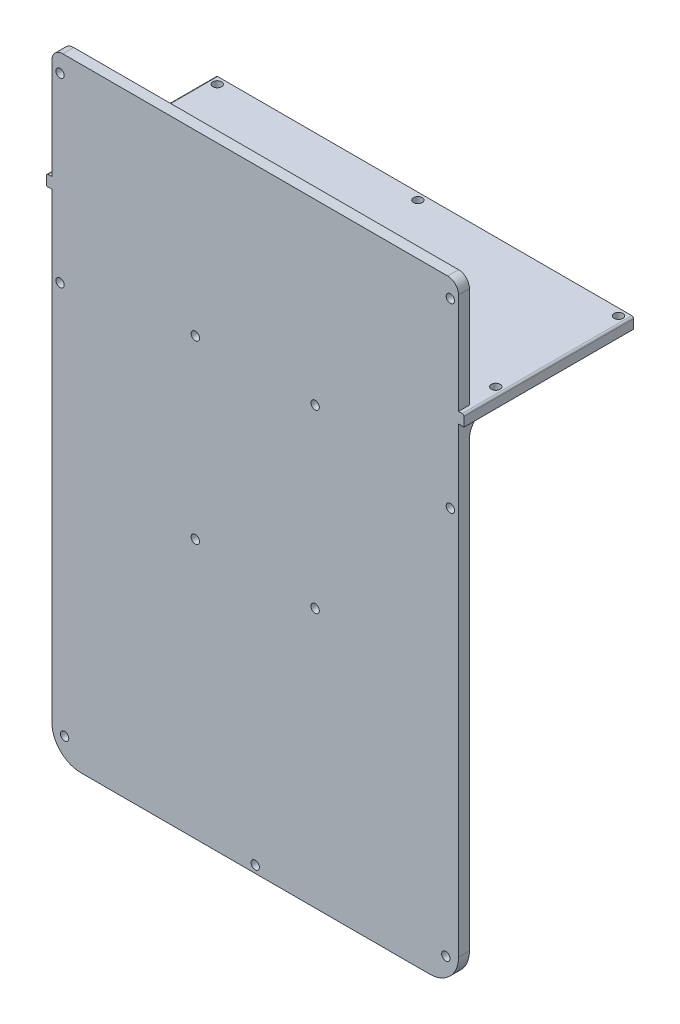
from build123d import *

# Parameters (mm, degrees)
BOSS_EXTRUDE3_DEPTH = 3
SKETCH3_W           = 115
SKETCH3_H           = 46.7
BOSS_EXTRUDE4_DEPTH = 3
FILLET3_R           = 5
FILLET6_R           = 0.5
SKETCH4_R           = 1.15
CUT_EXTRUDE1_DEPTH  = 161.690175681
SKETCH5_R           = 1.2
CUT_EXTRUDE2_DEPTH  = 154.280722858
SKETCH6_R           = 1.15
CUT_EXTRUDE6_DEPTH  = 161.690175681


with BuildPart() as part:
    # Sketch1 → Boss-Extrude3 (new body)
    with BuildSketch(Plane.XY):
        with BuildLine():
            Line((53, 143.545785589), (-53, 143.545785589))
            ThreePointArc((-53, 143.545785589), (-55.121320344, 142.667105932), (-56, 140.545785589))
            Line((-56, 140.545785589), (-56, -17.454214411))
            ThreePointArc((-56, -17.454214411), (-53.656854249, -23.111068661), (-48, -25.454214411))
            Line((-48, -25.454214411), (48, -25.454214411))
            ThreePointArc((48, -25.454214411), (53.656854249, -23.111068661), (56, -17.454214411))
            Line((56, -17.454214411), (56, 140.545785589))
            ThreePointArc((56, 140.545785589), (55.121320344, 142.667105932), (53, 143.545785589))
        make_face()
    extrude(amount=BOSS_EXTRUDE3_DEPTH)

    # Sketch3 → Boss-Extrude4 (add)
    with BuildSketch(Plane(origin=(0, 109.745785589, 0), x_dir=(1, 0, 0), z_dir=(0, 1, 0))):
        with Locations((0, 20.35)):
            Rectangle(SKETCH3_W, SKETCH3_H)
    extrude(amount=BOSS_EXTRUDE4_DEPTH)

    # Fillet3
    fillet3_edges = [part.edges().sort_by_distance(p)[0] for p in [
        (0, 109.745785589, 0),
    ]]
    fillet(fillet3_edges, radius=FILLET3_R)

    # Fillet6
    fillet6_edges = [part.edges().sort_by_distance(p)[0] for p in [
        (57.5, 112.745785589, -20.35),
        (-57.5, 112.745785589, -20.35),
    ]]
    fillet(fillet6_edges, radius=FILLET6_R)

    # Sketch4 → Cut-Extrude1 (cut, through all)
    with BuildSketch(Plane(origin=(0, 0, 0), x_dir=(-1, 0, 0), z_dir=(0, 0, -1))):
        with Locations((-52.5, -18.954214411)):
            Circle(SKETCH4_R)
        with Locations((-53.75, 88.545785589)):
            Circle(SKETCH4_R)
        with Locations((-53.75, 138.545785589)):
            Circle(SKETCH4_R)
        with Locations((0, -23.454214411)):
            Circle(SKETCH4_R)
        with Locations((52.5, -18.954214411)):
            Circle(SKETCH4_R)
        with Locations((53.75, 88.545785589)):
            Circle(SKETCH4_R)
        with Locations((53.75, 138.545785589)):
            Circle(SKETCH4_R)
    extrude(amount=-CUT_EXTRUDE1_DEPTH, mode=Mode.SUBTRACT)

    # Sketch5 → Cut-Extrude2 (cut, through all)
    with BuildSketch(Plane.XZ.offset(-109.745785589)):
        with Locations((55.25, -8)):
            Circle(SKETCH5_R)
        with Locations((55.25, -41.8)):
            Circle(SKETCH5_R)
        with Locations((0, -41.8)):
            Circle(SKETCH5_R)
        with Locations((-55.25, -8)):
            Circle(SKETCH5_R)
        with Locations((-55.25, -41.8)):
            Circle(SKETCH5_R)
    extrude(amount=-CUT_EXTRUDE2_DEPTH, mode=Mode.SUBTRACT)

    # Sketch6 → Cut-Extrude6 (cut, through all)
    with BuildSketch(Plane(origin=(0, 0, 0), x_dir=(-1, 0, 0), z_dir=(0, 0, -1))):
        with Locations((-16.5, 46)):
            Circle(SKETCH6_R)
        with Locations((16.5, 46)):
            Circle(SKETCH6_R)
        with Locations((16.5, 94.5)):
            Circle(SKETCH6_R)
        with Locations((-16.5, 94.5)):
            Circle(SKETCH6_R)
    extrude(amount=-CUT_EXTRUDE6_DEPTH, mode=Mode.SUBTRACT)


solid = part.part
